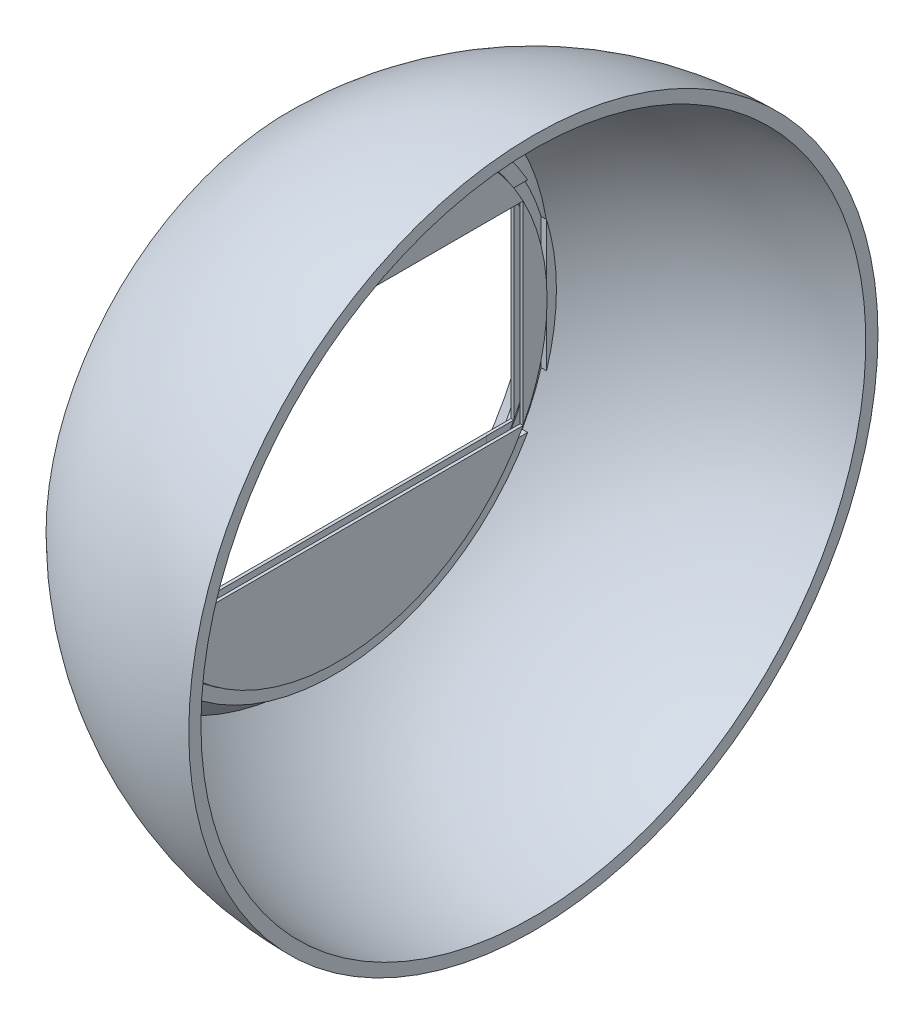
from build123d import *

# Parameters (mm, degrees)
BOSS_EXTRUDE1_DEPTH   = 2
BOSS_EXTRUDE1_2_DEPTH = 2
BOSS_EXTRUDE1_3_DEPTH = 2
BOSS_EXTRUDE1_4_DEPTH = 2
SKETCH9_W             = 1
SKETCH9_H             = 61
CUT_EXTRUDE1_DEPTH    = 2
SKETCH10_W            = 1
SKETCH10_H            = 61
CUT_EXTRUDE2_DEPTH    = 2
SKETCH12_W            = 1
SKETCH12_H            = 36
CUT_EXTRUDE3_DEPTH    = 2
SKETCH13_W            = 1
SKETCH13_H            = 36
CUT_EXTRUDE8_DEPTH    = 4.5


with BuildPart() as part:
    # Sketch1 → Revolve1 (revolve)
    with BuildSketch(Plane.XY):
        with BuildLine():
            Line((-40.206859547, 40), (-34.828674339, 34.621814792))
            Line((-34.828674339, 34.621814792), (-32.828674339, 34.621814792))
            Line((-32.828674339, 34.621814792), (-32.828674339, 36.621814792))
            Line((-32.828674339, 36.621814792), (-34.000247215, 36.621814792))
            Line((-34.000247215, 36.621814792), (-37.356354939, 39.977922516))
            ThreePointArc((-37.356354939, 39.977922516), (-20.079086089, 50.897562268), (0, 54.715002906))
            Line((0, 54.715002906), (0, 56.715002906))
            ThreePointArc((0, 56.715002906), (-21.771442745, 52.369798887), (-40.206859547, 40))
        make_face()
    revolve(axis=Axis((-112.648728237, 0, 0), (1, 0, 0)))


with BuildPart() as body_2:
    # Sketch7 → Boss-Extrude1 (new body)
    with BuildSketch(Plane(origin=(-34.185, 0, 0), x_dir=(0, 0, -1), z_dir=(1, 0, 0))):
        with BuildLine():
            ThreePointArc((30.5, 16), (0, 34.441980199), (-30.5, 16))
            Line((-30.5, 16), (30.5, 16))
        make_face()
    extrude(amount=BOSS_EXTRUDE1_DEPTH)


with BuildPart() as body_3:
    # Sketch7 → Boss-Extrude1 2 (new body)
    with BuildSketch(Plane(origin=(-34.185, 0, 0), x_dir=(0, 0, -1), z_dir=(1, 0, 0))):
        with BuildLine():
            Line((-30.5, -16), (-30.5, 16))
            ThreePointArc((-30.5, 16), (-34.441980199, 0), (-30.5, -16))
        make_face()
    extrude(amount=BOSS_EXTRUDE1_2_DEPTH)


with BuildPart() as body_4:
    # Sketch7 → Boss-Extrude1 3 (new body)
    with BuildSketch(Plane(origin=(-34.185, 0, 0), x_dir=(0, 0, -1), z_dir=(1, 0, 0))):
        with BuildLine():
            ThreePointArc((30.5, -16), (34.441980199, 0), (30.5, 16))
            Line((30.5, 16), (30.5, -16))
        make_face()
    extrude(amount=BOSS_EXTRUDE1_3_DEPTH)


with BuildPart() as body_5:
    # Sketch7 → Boss-Extrude1 4 (new body)
    with BuildSketch(Plane(origin=(-34.185, 0, 0), x_dir=(0, 0, -1), z_dir=(1, 0, 0))):
        with BuildLine():
            Line((30.5, -16), (-30.5, -16))
            ThreePointArc((-30.5, -16), (0, -34.441980199), (30.5, -16))
        make_face()
    extrude(amount=BOSS_EXTRUDE1_4_DEPTH)


with BuildPart() as cut_extrude1_tool:
    # Sketch9 → Cut-Extrude1 (new body)
    with BuildSketch(Plane.XZ.offset(-16)):
        with Locations((-33.185, 0)):
            Rectangle(SKETCH9_W, SKETCH9_H)
    extrude(amount=-CUT_EXTRUDE1_DEPTH)


with BuildPart() as part_1:
    add(part.part)

    # Cut-Extrude1: cut by cut_extrude1_tool
    add(cut_extrude1_tool.part, mode=Mode.SUBTRACT)


with BuildPart() as body_2_1:
    add(body_2.part)

    # Cut-Extrude1: cut by cut_extrude1_tool
    add(cut_extrude1_tool.part, mode=Mode.SUBTRACT)


with BuildPart() as cut_extrude2_tool:
    # Sketch10 → Cut-Extrude2 (new body)
    with BuildSketch(Plane(origin=(0, -16, 0), x_dir=(1, 0, 0), z_dir=(0, 1, 0))):
        with Locations((-33.185, 0)):
            Rectangle(SKETCH10_W, SKETCH10_H)
    extrude(amount=-CUT_EXTRUDE2_DEPTH)


with BuildPart() as part_2:
    add(part_1.part)

    # Cut-Extrude2: cut by cut_extrude2_tool
    add(cut_extrude2_tool.part, mode=Mode.SUBTRACT)


with BuildPart() as body_5_1:
    add(body_5.part)

    # Cut-Extrude2: cut by cut_extrude2_tool
    add(cut_extrude2_tool.part, mode=Mode.SUBTRACT)


with BuildPart() as cut_extrude3_tool:
    # Sketch12 → Cut-Extrude3 (new body)
    with BuildSketch(Plane(origin=(0, 0, 30.5), x_dir=(-1, 0, 0), z_dir=(0, 0, -1))):
        with Locations((33.185, 0)):
            Rectangle(SKETCH12_W, SKETCH12_H)
    extrude(amount=-CUT_EXTRUDE3_DEPTH)


with BuildPart() as part_3:
    add(part_2.part)

    # Cut-Extrude3: cut by cut_extrude3_tool
    add(cut_extrude3_tool.part, mode=Mode.SUBTRACT)


with BuildPart() as body_3_1:
    add(body_3.part)

    # Cut-Extrude3: cut by cut_extrude3_tool
    add(cut_extrude3_tool.part, mode=Mode.SUBTRACT)


with BuildPart() as cut_extrude8_tool:
    # Sketch13 → Cut-Extrude8 (new, symmetric)
    with BuildSketch(Plane.XY.offset(-30.5)):
        with Locations((-33.225443476, 0)):
            Rectangle(SKETCH13_W, SKETCH13_H)
    extrude(amount=CUT_EXTRUDE8_DEPTH, both=True)


with BuildPart() as part_4:
    add(part_3.part)

    # Cut-Extrude8: cut by cut_extrude8_tool
    add(cut_extrude8_tool.part, mode=Mode.SUBTRACT)


with BuildPart() as body_2_2:
    add(body_2_1.part)

    # Cut-Extrude8: cut by cut_extrude8_tool
    add(cut_extrude8_tool.part, mode=Mode.SUBTRACT)


with BuildPart() as body_4_1:
    add(body_4.part)

    # Cut-Extrude8: cut by cut_extrude8_tool
    add(cut_extrude8_tool.part, mode=Mode.SUBTRACT)


with BuildPart() as body_5_2:
    add(body_5_1.part)

    # Cut-Extrude8: cut by cut_extrude8_tool
    add(cut_extrude8_tool.part, mode=Mode.SUBTRACT)


solid = Compound([body_3_1.part, part_4.part, body_2_2.part, body_4_1.part, body_5_2.part])
